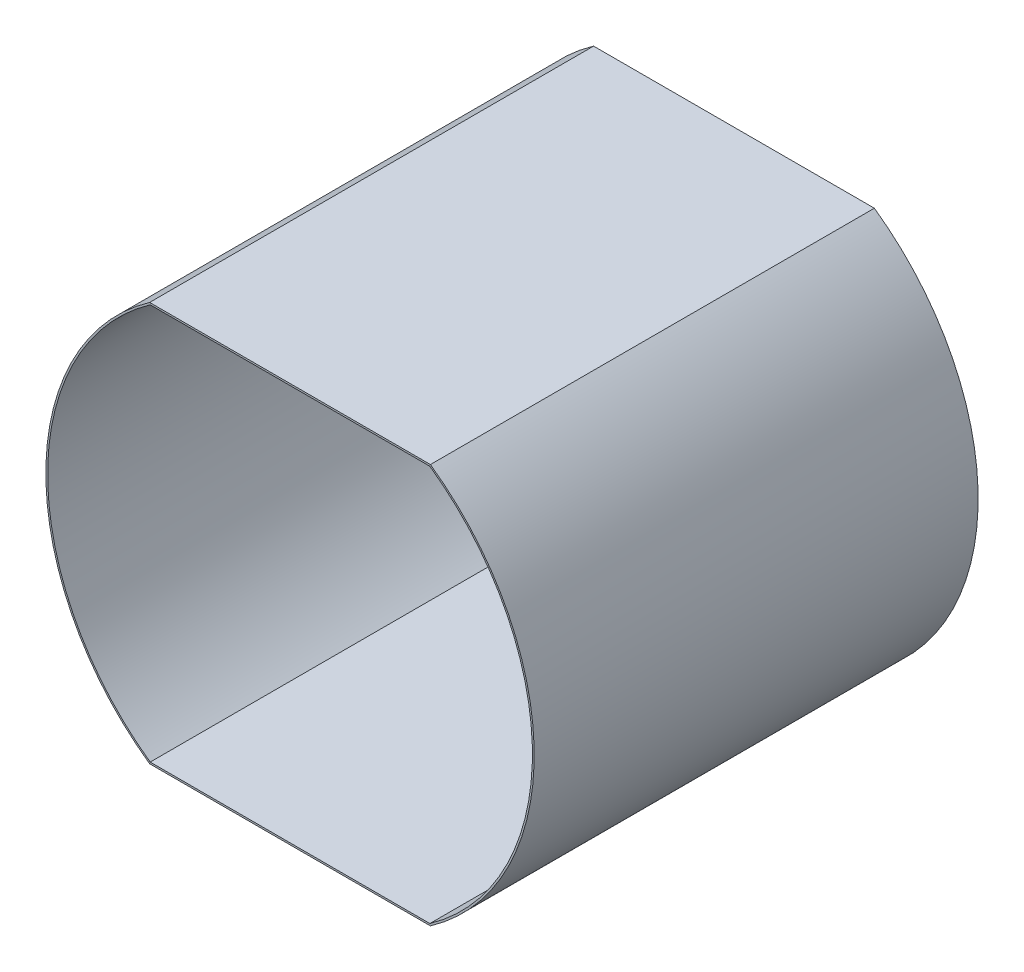
from build123d import *

# Parameters (mm, degrees)
SKETCH2_R           = 2
BOSS_EXTRUDE8_DEPTH = 50
SHELL4_T            = -0.2


with BuildPart() as part:
    # Sketch2 → Boss-Extrude8 (new body)
    with BuildSketch(Plane.XY):
        with BuildLine():
            Line((15.811388301, 22.5), (-15.811388301, 22.5))
            ThreePointArc((-15.811388301, 22.5), (-27.5, 0), (-15.811388301, -22.5))
            Line((-15.811388301, -22.5), (15.811388301, -22.5))
            ThreePointArc((15.811388301, -22.5), (27.5, 0), (15.811388301, 22.5))
        make_face()
        Circle(SKETCH2_R, mode=Mode.SUBTRACT)
    extrude(amount=BOSS_EXTRUDE8_DEPTH)

    # Shell4
    shell4_openings = [part.faces().sort_by_distance(p)[0] for p in [
        (-2, 0, 25),
        (0, -21.78936648, 50),
    ]]
    offset(amount=SHELL4_T, openings=shell4_openings, kind=Kind.INTERSECTION)


solid = part.part
